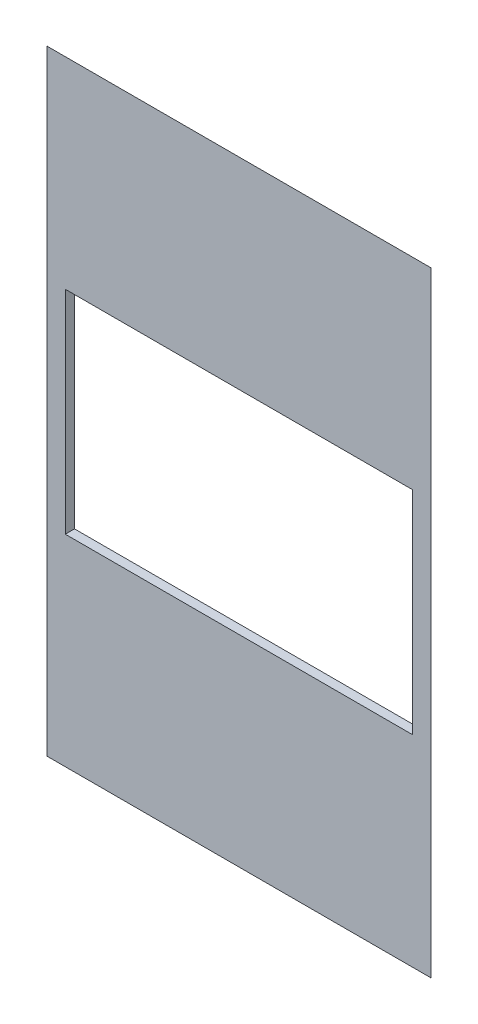
from build123d import *

# Parameters (mm, degrees)
SKETCH1_W           = 500
SKETCH1_H           = 800
BOSS_EXTRUDE1_DEPTH = 12
SKETCH1_5_W         = 452
SKETCH1_5_H         = 276
CUT_EXTRUDE1_DEPTH  = 944.474429966
CHAMFER1_SIZE       = 12


with BuildPart() as part:
    # Sketch1 → Boss-Extrude1 (new body)
    with BuildSketch(Plane.XY):
        with Locations((250, 400)):
            Rectangle(SKETCH1_W, SKETCH1_H)
    extrude(amount=BOSS_EXTRUDE1_DEPTH)

    # Sketch1<5> → Cut-Extrude1 (cut, through all)
    with BuildSketch(Plane.XY):
        with Locations((250, 400)):
            Rectangle(SKETCH1_5_W, SKETCH1_5_H)
    extrude(amount=CUT_EXTRUDE1_DEPTH, mode=Mode.SUBTRACT)

    # Chamfer1
    chamfer1_edges = [part.edges().sort_by_distance(p)[0] for p in [
        (250, 0, 0),
        (0, 400, 0),
        (250, 800, 0),
        (500, 400, 0),
    ]]
    chamfer(chamfer1_edges, length=CHAMFER1_SIZE - 0.0001)  # a hair under: the kernel refuses the full size


solid = part.part
